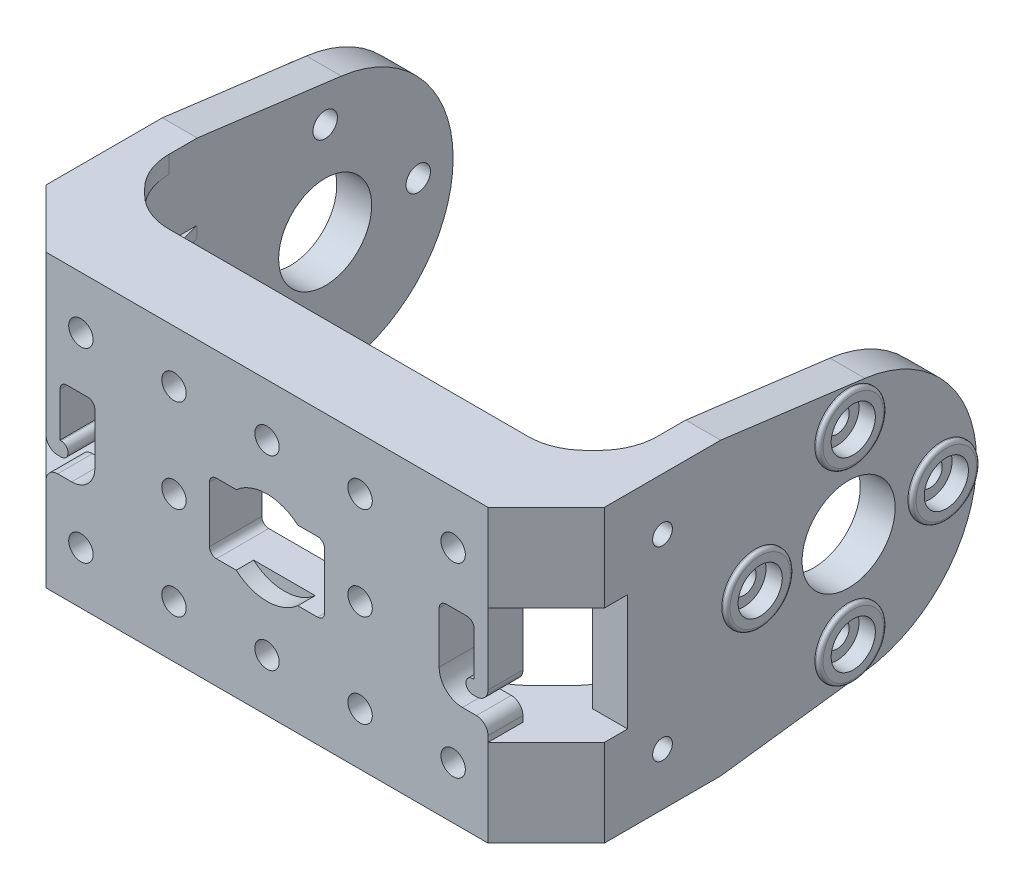
from build123d import *

# Parameters (mm, degrees)
BOSS_EXTRU_1_DEPTH                  = 1
BOSS_EXTRU_2_DEPTH                  = 0.5
ENL_V_MAT_EXTRU_1_DEPTH             = 1
ENL_V_MAT_EXTRU_2_DEPTH             = 1
ENL_V_MAT_EXTRU_3_DEPTH             = 1
ENL_V_MAT_EXTRU_4_DEPTH             = 1
BOSS_EXTRU_3_DEPTH                  = 1
BOSS_EXTRU_4_DEPTH                  = 1
BOSS_EXTRU_5_DEPTH                  = 5
BOSS_EXTRU_6_DEPTH                  = 5
BOSS_EXTRU_7_DEPTH                  = 1.5
ENL_V_MAT_EXTRU_5_DEPTH             = 6
BOSS_EXTRU_8_DEPTH                  = 1.5
BOSS_EXTRU_9_DEPTH                  = 3
BOSS_EXTRU_10_START                 = 3
BOSS_EXTRU_10_DEPTH                 = 3
ENL_V_MAT_EXTRU_6_DEPTH             = 6
ENL_V_MAT_EXTRU_7_DEPTH             = 1.5
ENL_V_MAT_EXTRU_8_DEPTH             = 1.5
ENL_V_MAT_EXTRU_9_DEPTH             = 5
ENL_V_MAT_EXTRU_10_DEPTH            = 1.5
ENL_V_MAT_EXTRU_11_DEPTH            = 1.5
ENL_V_MAT_EXTRU_12_DEPTH            = 5
ESQUISSE23_W                        = 0.5
ESQUISSE23_H                        = 7
ENL_V_MAT_EXTRU_13_DEPTH            = 1.743065645
ESQUISSE24_W                        = 0.5
ESQUISSE24_H                        = 7
ENL_V_MAT_EXTRU_14_DEPTH            = 1.743065645
ESQUISSE25_W                        = 0.5
ESQUISSE25_H                        = 7
ENL_V_MAT_EXTRU_15_DEPTH            = 2.337822174
ESQUISSE26_W                        = 0.5
ESQUISSE26_H                        = 7
ENL_V_MAT_EXTRU_16_DEPTH            = 2.337822174
BOSS_EXTRU_11_DEPTH                 = 3
ENL_V_MAT_EXTRU_17_DEPTH            = 1
ENL_V_MAT_EXTRU_18_DEPTH            = 1.5
ENL_V_MAT_EXTRU_19_DEPTH            = 1
ENL_V_MAT_EXTRU_20_DEPTH            = 1
ENL_V_MAT_EXTRU_21_DEPTH            = 1
ENL_V_MAT_EXTRU_22_DEPTH            = 0.5
ENL_V_MAT_EXTRU_23_DEPTH            = 1
ENL_V_MAT_EXTRU_24_DEPTH            = 1
ENL_V_MAT_EXTRU_25_DEPTH            = 1
ENL_V_MAT_EXTRU_26_DEPTH            = 1
ENL_V_MAT_EXTRU_27_DEPTH            = 2
ENL_V_MAT_EXTRU_28_DEPTH            = 1
ENL_V_MAT_EXTRU_29_DEPTH            = 2
ENL_V_MAT_EXTRU_30_DEPTH            = 1
ENL_V_MAT_EXTRU_31_DEPTH            = 2
ENL_V_MAT_EXTRU_32_DEPTH            = 1
ENL_V_MAT_EXTRU_33_DEPTH            = 2
ENL_V_MAT_EXTRU_34_DEPTH            = 1
ENL_V_MAT_EXTRU_35_DEPTH            = 2
ENL_V_MAT_EXTRU_36_DEPTH            = 1
ENL_V_MAT_EXTRU_37_DEPTH            = 1
ENL_V_MAT_EXTRU_38_DEPTH            = 2
ENL_V_MAT_EXTRU_39_DEPTH            = 1
ENL_V_MAT_EXTRU_40_DEPTH            = 1
ESQUISSE52_W                        = 9.9
ESQUISSE52_H                        = 6
ENL_V_MAT_EXTRU_41_DEPTH            = 46.839393539
ENL_V_MAT_EXTRU_42_DEPTH            = 1.5
ENL_V_MAT_EXTRU_43_DEPTH            = 1.5
ENL_V_MAT_EXTRU_44_DEPTH            = 2
ENL_V_MAT_EXTRU_45_DEPTH            = 2
ENL_V_MAT_EXTRU_46_DEPTH            = 2
ENL_V_MAT_EXTRU_47_DEPTH            = 2
ENL_V_MAT_EXTRU_48_DEPTH            = 2
ENL_V_MAT_EXTRU_49_DEPTH            = 2
ESQUISSE61_W                        = 0.4
ESQUISSE61_H                        = 2.9
ESQUISSE62_W                        = 0.4
ESQUISSE62_H                        = 2.9
ESQUISSE63_W                        = 0.4
ESQUISSE63_H                        = 2.9
ESQUISSE64_W                        = 0.4
ESQUISSE64_H                        = 2.9
ESQUISSE65_W                        = 0.4
ESQUISSE65_H                        = 2.9
ESQUISSE66_W                        = 0.4
ESQUISSE66_H                        = 2.9
ESQUISSE67_W                        = 0.4
ESQUISSE67_H                        = 2.9
ESQUISSE68_W                        = 0.4
ESQUISSE68_H                        = 2.9
DIAM_TRE_DU_PER_AGE_2_1_2_1_1_D     = 2.1
DIAM_TRE_DU_PER_AGE_1_7_1_7_1_D     = 1.7
DIAM_TRE_DU_PER_AGE_1_7_1_7_1_DEPTH = 3
DIAM_TRE_DU_PER_AGE_8_0_8_1_D       = 8
DIAM_TRE_DU_PER_AGE_8_0_8_1_DEPTH   = 3
DIAM_TRE_DU_PER_AGE_1_7_1_7_2_D     = 1.7
DIAM_TRE_DU_PER_AGE_1_7_1_7_2_DEPTH = 48.4
DIAM_TRE_DU_PER_AGE_8_0_8_2_D       = 8
DIAM_TRE_DU_PER_AGE_8_0_8_2_DEPTH   = 48.4
PER_AGE1_D                          = 2.1
PER_AGE1_DEPTH                      = 3.4
PER_AGE1_CBORE_D                    = 3.8
PER_AGE1_CBORE_DEPTH                = 1.4
PER_AGE2_D                          = 2.1
PER_AGE2_DEPTH                      = 48.8
PER_AGE2_CBORE_D                    = 3.8
PER_AGE2_CBORE_DEPTH                = 1.4
CHANFREIN1_SIZE                     = 5
CONG_1_R                            = 0.3
CONG_2_R                            = 0.6
CONG_3_R                            = 1
CONG_4_R                            = 2
CONG_5_R                            = 5


with BuildPart() as part:
    # Esquisse1 → Boss.-Extru.1 (new body)
    with BuildSketch(Plane.XY.offset(23)):
        Polygon((14.595606444, -5), (10.080887819, -3.5), (10.080887819, -2.493640581), (11.2, -1.847520861), (11.2, 1.847520861), (10.080887819, 2.493640581), (10.080887819, 3.5), (14.595606444, 5), (-14.595606444, 5), (-10.080887819, 3.5), (-10.080887819, 2.493640581), (-11.2, 1.847520861), (-11.2, -1.847520861), (-10.080887819, -2.493640581), (-10.080887819, -3.5), (-14.595606444, -5), align=None)
    extrude(amount=-BOSS_EXTRU_1_DEPTH)

    # Esquisse2 → Boss.-Extru.2 (add)
    with BuildSketch(Plane(origin=(0, 0, 22), x_dir=(-1, 0, 0), z_dir=(0, 0, -1))):
        Polygon((-14.595606444, 5), (14.595606444, 5), (10.080887819, 3.5), (10.080887819, -3.5), (14.595606444, -5), (-14.595606444, -5), (-10.080887819, -3.5), (-10.080887819, 3.5), align=None)
    extrude(amount=BOSS_EXTRU_2_DEPTH)

    # Esquisse3 → Enlèv. mat.-Extru.1 (cut)
    with BuildSketch(Plane.XY.offset(23)):
        Polygon((10.080887819, 3.5), (8.337822174, 3.5), (10.080887819, 2.493640581), align=None)
    extrude(amount=-ENL_V_MAT_EXTRU_1_DEPTH, mode=Mode.SUBTRACT)

    # Esquisse4 → Enlèv. mat.-Extru.2 (cut)
    with BuildSketch(Plane.XY.offset(23)):
        Polygon((10.080887819, -3.5), (10.080887819, -2.493640581), (8.337822174, -3.5), align=None)
    extrude(amount=-ENL_V_MAT_EXTRU_2_DEPTH, mode=Mode.SUBTRACT)

    # Esquisse5 → Enlèv. mat.-Extru.3 (cut)
    with BuildSketch(Plane.XY.offset(23)):
        Polygon((-10.080887819, -3.5), (-8.337822174, -3.5), (-10.080887819, -2.493640581), align=None)
    extrude(amount=-ENL_V_MAT_EXTRU_3_DEPTH, mode=Mode.SUBTRACT)

    # Esquisse6 → Enlèv. mat.-Extru.4 (cut)
    with BuildSketch(Plane.XY.offset(23)):
        Polygon((-10.080887819, 3.5), (-10.080887819, 2.493640581), (-8.337822174, 3.5), align=None)
    extrude(amount=-ENL_V_MAT_EXTRU_4_DEPTH, mode=Mode.SUBTRACT)

    # Esquisse7 → Boss.-Extru.3 (add)
    with BuildSketch(Plane(origin=(0, 5, 0), x_dir=(-1, 0, 0), z_dir=(0, 1, 0))):
        Polygon((21, 23), (21, 11), (19.5, 17.014718626), (17.514718626, 19), (-17.514718626, 19), (-19.5, 17.014718626), (-21, 11), (-21, 23), align=None)
    extrude(amount=BOSS_EXTRU_3_DEPTH)

    # Esquisse8 → Boss.-Extru.4 (add)
    with BuildSketch(Plane.XZ.offset(5)):
        Polygon((-21, 11), (-21, 23), (21, 23), (21, 11), (19.5, 17.014718626), (17.514718626, 19), (-17.514718626, 19), (-19.5, 17.014718626), align=None)
    extrude(amount=BOSS_EXTRU_4_DEPTH)

    # Esquisse9 → Boss.-Extru.5 (add)
    with BuildSketch(Plane(origin=(0, 6, 0), x_dir=(-1, 0, 0), z_dir=(0, 1, 0))):
        Polygon((21, 23), (21, 11), (19.5, 17.014718626), (17.514718626, 19), (-17.514718626, 19), (-19.5, 17.014718626), (-21, 11), (-21, 23), align=None)
    extrude(amount=BOSS_EXTRU_5_DEPTH)

    # Esquisse10 → Boss.-Extru.6 (add)
    with BuildSketch(Plane.XZ.offset(6)):
        Polygon((-21, 11), (-21, 23), (21, 23), (21, 11), (19.5, 17.014718626), (17.514718626, 19), (-17.514718626, 19), (-19.5, 17.014718626), align=None)
    extrude(amount=BOSS_EXTRU_6_DEPTH)

    # Esquisse11 → Boss.-Extru.7 (add)
    with BuildSketch(Plane(origin=(0, 11, 0), x_dir=(-1, 0, 0), z_dir=(0, 1, 0))):
        Polygon((21, 23), (21, 11), (19.5, 17.014718626), (17.514718626, 19), (-17.514718626, 19), (-19.5, 17.014718626), (-21, 11), (-21, 23), align=None)
    extrude(amount=BOSS_EXTRU_7_DEPTH)

    # Esquisse12 → Enlèv. mat.-Extru.5 (cut)
    with BuildSketch(Plane.XZ.offset(-5)):
        Polygon((-17.514718626, 19), (17.514718626, 19), (15.014718626, 21.5), (-15.014718626, 21.5), align=None)
    extrude(amount=-ENL_V_MAT_EXTRU_5_DEPTH, mode=Mode.SUBTRACT)

    # Esquisse13 → Boss.-Extru.8 (add)
    with BuildSketch(Plane.XZ.offset(11)):
        Polygon((-21, 11), (-21, 23), (21, 23), (21, 11), (19.5, 17.014718626), (17.514718626, 19), (-17.514718626, 19), (-19.5, 17.014718626), align=None)
    extrude(amount=BOSS_EXTRU_8_DEPTH)

    # Esquisse14 → Boss.-Extru.9 (add)
    with BuildSketch(Plane.ZY.offset(21)):
        with BuildLine():
            Line((23, 12.5), (23, 5))
            Line((23, 5), (19, 5))
            Line((19, 5), (19, -5))
            Line((19, -5), (23, -5))
            Line((23, -5), (23, -12.5))
            Line((23, -12.5), (11, -12.5))
            Line((11, -12.5), (-1.398557259, -10.910730388))
            ThreePointArc((-1.398557259, -10.910730388), (-11, 0), (-1.398557259, 10.910730388))
            Line((-1.398557259, 10.910730388), (11, 12.5))
            Line((11, 12.5), (23, 12.5))
        make_face()
    extrude(amount=BOSS_EXTRU_9_DEPTH)

    # Esquisse15 → Boss.-Extru.10 (add)
    with BuildSketch(Plane(origin=(21, 0, 0), x_dir=(0, 0, -1), z_dir=(1, 0, 0)).offset(BOSS_EXTRU_10_START)):
        with BuildLine():
            Line((-23, 12.5), (-11, 12.5))
            Line((-11, 12.5), (1.398557259, 10.910730388))
            ThreePointArc((1.398557259, 10.910730388), (11, 0), (1.398557259, -10.910730388))
            Line((1.398557259, -10.910730388), (-11, -12.5))
            Line((-11, -12.5), (-23, -12.5))
            Line((-23, -12.5), (-23, -5))
            Line((-23, -5), (-19, -5))
            Line((-19, -5), (-19, 5))
            Line((-19, 5), (-23, 5))
            Line((-23, 5), (-23, 12.5))
        make_face()
    extrude(amount=-BOSS_EXTRU_10_DEPTH)

    # Esquisse16 → Enlèv. mat.-Extru.6 (cut)
    with BuildSketch(Plane(origin=(0, -5, 0), x_dir=(-1, 0, 0), z_dir=(0, 1, 0))):
        Polygon((17.514718626, 19), (15.014718626, 21.5), (-15.014718626, 21.5), (-17.514718626, 19), align=None)
    extrude(amount=-ENL_V_MAT_EXTRU_6_DEPTH, mode=Mode.SUBTRACT)

    # Esquisse17 → Enlèv. mat.-Extru.7 (cut)
    with BuildSketch(Plane.XZ.offset(12.5)):
        Polygon((21, 15.514718626), (19.5, 17.014718626), (21, 11), align=None)
    extrude(amount=-ENL_V_MAT_EXTRU_7_DEPTH, mode=Mode.SUBTRACT)

    # Esquisse18 → Enlèv. mat.-Extru.8 (cut)
    with BuildSketch(Plane.XZ.offset(12.5)):
        Polygon((-19.5, 17.014718626), (-21, 15.514718626), (-21, 11), align=None)
    extrude(amount=-ENL_V_MAT_EXTRU_8_DEPTH, mode=Mode.SUBTRACT)

    # Esquisse19 → Enlèv. mat.-Extru.9 (cut)
    with BuildSketch(Plane.XZ.offset(11)):
        Polygon((21, 22), (-21, 22), (-21, 11), (-19.5, 17.014718626), (-15.014718626, 21.5), (15.014718626, 21.5), (19.5, 17.014718626), (21, 11), align=None)
    extrude(amount=-ENL_V_MAT_EXTRU_9_DEPTH, mode=Mode.SUBTRACT)

    # Esquisse20 → Enlèv. mat.-Extru.10 (cut)
    with BuildSketch(Plane(origin=(0, 12.5, 0), x_dir=(-1, 0, 0), z_dir=(0, 1, 0))):
        Polygon((-21, 11), (-19.5, 17.014718626), (-21, 15.514718626), align=None)
    extrude(amount=-ENL_V_MAT_EXTRU_10_DEPTH, mode=Mode.SUBTRACT)

    # Esquisse21 → Enlèv. mat.-Extru.11 (cut)
    with BuildSketch(Plane(origin=(0, 12.5, 0), x_dir=(-1, 0, 0), z_dir=(0, 1, 0))):
        Polygon((21, 11), (21, 15.514718626), (19.5, 17.014718626), align=None)
    extrude(amount=-ENL_V_MAT_EXTRU_11_DEPTH, mode=Mode.SUBTRACT)

    # Esquisse22 → Enlèv. mat.-Extru.12 (cut)
    with BuildSketch(Plane(origin=(0, 11, 0), x_dir=(-1, 0, 0), z_dir=(0, 1, 0))):
        Polygon((21, 11), (21, 22), (-21, 22), (-21, 11), (-19.5, 17.014718626), (-15.014718626, 21.5), (15.014718626, 21.5), (19.5, 17.014718626), align=None)
    extrude(amount=-ENL_V_MAT_EXTRU_12_DEPTH, mode=Mode.SUBTRACT)

    # Esquisse23 → Enlèv. mat.-Extru.13 (cut)
    with BuildSketch(Plane.ZY.offset(10.080887819)):
        with Locations((21.75, 0)):
            Rectangle(ESQUISSE23_W, ESQUISSE23_H)
    extrude(amount=-ENL_V_MAT_EXTRU_13_DEPTH, mode=Mode.SUBTRACT)

    # Esquisse24 → Enlèv. mat.-Extru.14 (cut)
    with BuildSketch(Plane(origin=(10.080887819, 0, 0), x_dir=(0, 0, -1), z_dir=(1, 0, 0))):
        with Locations((-21.75, 0)):
            Rectangle(ESQUISSE24_W, ESQUISSE24_H)
    extrude(amount=-ENL_V_MAT_EXTRU_14_DEPTH, mode=Mode.SUBTRACT)

    # Esquisse25 → Enlèv. mat.-Extru.15 (cut)
    with BuildSketch(Plane.ZY.offset(8.337822174)):
        with Locations((21.75, 0)):
            Rectangle(ESQUISSE25_W, ESQUISSE25_H)
    extrude(amount=-ENL_V_MAT_EXTRU_15_DEPTH, mode=Mode.SUBTRACT)

    # Esquisse26 → Enlèv. mat.-Extru.16 (cut)
    with BuildSketch(Plane(origin=(8.337822174, 0, 0), x_dir=(0, 0, -1), z_dir=(1, 0, 0))):
        with Locations((-21.75, 0)):
            Rectangle(ESQUISSE26_W, ESQUISSE26_H)
    extrude(amount=-ENL_V_MAT_EXTRU_16_DEPTH, mode=Mode.SUBTRACT)

    # Esquisse27 → Boss.-Extru.11 (add)
    with BuildSketch(Plane.XY.offset(23)):
        with BuildLine():
            Line((14.8, -3.5), (19, -3.5))
            Line((19, -3.5), (19, -5))
            Line((19, -5), (24, -5))
            Line((24, -5), (24, -12.5))
            Line((24, -12.5), (-24, -12.5))
            Line((-24, -12.5), (-24, -5))
            Line((-24, -5), (-19, -5))
            Line((-19, -5), (-19, -3.5))
            Line((-19, -3.5), (-14.8, -3.5))
            Line((-14.8, -3.5), (-14.8, 3.5))
            Line((-14.8, 3.5), (-17.8, 3.5))
            Line((-17.8, 3.5), (-17.8, -0.9))
            Line((-17.8, -0.9), (-17.7, -0.9))
            ThreePointArc((-17.7, -0.9), (-17.1, -1.5), (-17.7, -2.1))
            Line((-17.7, -2.1), (-19, -2.1))
            Line((-19, -2.1), (-19, 5))
            Line((-19, 5), (-24, 5))
            Line((-24, 5), (-24, 12.5))
            Line((-24, 12.5), (24, 12.5))
            Line((24, 12.5), (24, 5))
            Line((24, 5), (19, 5))
            Line((19, 5), (19, -2.1))
            Line((19, -2.1), (17.7, -2.1))
            ThreePointArc((17.7, -2.1), (17.1, -1.5), (17.7, -0.9))
            Line((17.7, -0.9), (17.8, -0.9))
            Line((17.8, -0.9), (17.8, 3.5))
            Line((17.8, 3.5), (14.8, 3.5))
            Line((14.8, 3.5), (14.8, -3.5))
        make_face()
    extrude(amount=BOSS_EXTRU_11_DEPTH)

    # Esquisse28 → Enlèv. mat.-Extru.17 (cut)
    with BuildSketch(Plane(origin=(0, 0, 22), x_dir=(-1, 0, 0), z_dir=(0, 0, -1))):
        Polygon((13.690598923, -6), (10.935898385, -6), (11.2, -6.152479139), (11.2, -9.847520861), (9.203847577, -11), (14.267949192, -11), (12.535898385, -8), align=None)
    extrude(amount=-ENL_V_MAT_EXTRU_17_DEPTH, mode=Mode.SUBTRACT)

    # Esquisse29 → Enlèv. mat.-Extru.18 (cut)
    with BuildSketch(Plane(origin=(0, 0, 21.5), x_dir=(-1, 0, 0), z_dir=(0, 0, -1))):
        Polygon((9.919112181, -4.5), (-9.919112181, -4.5), (-14.433830807, -6), (14.433830807, -6), align=None)
    extrude(amount=-ENL_V_MAT_EXTRU_18_DEPTH, mode=Mode.SUBTRACT)

    # Esquisse30 → Enlèv. mat.-Extru.19 (cut)
    with BuildSketch(Plane(origin=(0, 0, 22), x_dir=(-1, 0, 0), z_dir=(0, 0, -1))):
        Polygon((-4.8, -6.152479139), (-4.8, -9.847520861), (-6.796152423, -11), (-1.203847577, -11), (-3.2, -9.847520861), (-3.2, -6.152479139), (-0.337822174, -4.5), (-7.662177826, -4.5), align=None)
    extrude(amount=-ENL_V_MAT_EXTRU_19_DEPTH, mode=Mode.SUBTRACT)

    # Esquisse31 → Enlèv. mat.-Extru.20 (cut)
    with BuildSketch(Plane(origin=(0, 0, 22), x_dir=(-1, 0, 0), z_dir=(0, 0, -1))):
        Polygon((3.2, -6.152479139), (3.2, -9.847520861), (1.203847577, -11), (6.796152423, -11), (4.8, -9.847520861), (4.8, -6.152479139), (7.662177826, -4.5), (0.337822174, -4.5), align=None)
    extrude(amount=-ENL_V_MAT_EXTRU_20_DEPTH, mode=Mode.SUBTRACT)

    # Esquisse32 → Enlèv. mat.-Extru.21 (cut)
    with BuildSketch(Plane(origin=(0, 0, 22), x_dir=(-1, 0, 0), z_dir=(0, 0, -1))):
        Polygon((-13.810221356, -5.792807868), (-12.535898385, -8), (-14.267949192, -11), (-9.203847577, -11), (-11.2, -9.847520861), (-11.2, -6.152479139), (-8.337822174, -4.5), (-9.919112181, -4.5), align=None)
    extrude(amount=-ENL_V_MAT_EXTRU_21_DEPTH, mode=Mode.SUBTRACT)

    # Esquisse33 → Enlèv. mat.-Extru.22 (cut)
    with BuildSketch(Plane(origin=(0, 0, 21.5), x_dir=(-1, 0, 0), z_dir=(0, 0, -1))):
        Polygon((-9.919112181, 4.5), (9.919112181, 4.5), (14.433830807, 6), (-14.433830807, 6), align=None)
    extrude(amount=-ENL_V_MAT_EXTRU_22_DEPTH, mode=Mode.SUBTRACT)

    # Esquisse34 → Enlèv. mat.-Extru.23 (cut)
    with BuildSketch(Plane(origin=(0, 0, 22), x_dir=(-1, 0, 0), z_dir=(0, 0, -1))):
        Polygon((13.810221356, 5.792807868), (12.535898385, 8), (14.267949192, 11), (9.203847577, 11), (11.2, 9.847520861), (11.2, 6.152479139), (8.337822174, 4.5), (9.919112181, 4.5), align=None)
    extrude(amount=-ENL_V_MAT_EXTRU_23_DEPTH, mode=Mode.SUBTRACT)

    # Esquisse35 → Enlèv. mat.-Extru.24 (cut)
    with BuildSketch(Plane(origin=(0, 0, 22), x_dir=(-1, 0, 0), z_dir=(0, 0, -1))):
        Polygon((-3.2, 6.152479139), (-3.2, 9.847520861), (-1.203847577, 11), (-6.796152423, 11), (-4.8, 9.847520861), (-4.8, 6.152479139), (-7.662177826, 4.5), (-0.337822174, 4.5), align=None)
    extrude(amount=-ENL_V_MAT_EXTRU_24_DEPTH, mode=Mode.SUBTRACT)

    # Esquisse36 → Enlèv. mat.-Extru.25 (cut)
    with BuildSketch(Plane(origin=(0, 0, 22), x_dir=(-1, 0, 0), z_dir=(0, 0, -1))):
        Polygon((-11.2, 6.152479139), (-11.2, 9.847520861), (-9.203847577, 11), (-14.267949192, 11), (-12.535898385, 8), (-13.810221356, 5.792807868), (-9.919112181, 4.5), (-8.337822174, 4.5), align=None)
    extrude(amount=-ENL_V_MAT_EXTRU_25_DEPTH, mode=Mode.SUBTRACT)

    # Esquisse37 → Enlèv. mat.-Extru.26 (cut)
    with BuildSketch(Plane(origin=(0, 0, 22), x_dir=(-1, 0, 0), z_dir=(0, 0, -1))):
        Polygon((4.8, 6.152479139), (4.8, 9.847520861), (6.796152423, 11), (1.203847577, 11), (3.2, 9.847520861), (3.2, 6.152479139), (0.337822174, 4.5), (7.662177826, 4.5), align=None)
    extrude(amount=-ENL_V_MAT_EXTRU_26_DEPTH, mode=Mode.SUBTRACT)

    # Esquisse38 → Enlèv. mat.-Extru.27 (cut)
    with BuildSketch(Plane(origin=(0, 0, 22), x_dir=(-1, 0, 0), z_dir=(0, 0, -1))):
        Polygon((17.154700538, -10), (18.309401077, -8), (17.154700538, -6), (14.845299462, -6), (13.690598923, -8), (14.845299462, -10), align=None)
    extrude(amount=-ENL_V_MAT_EXTRU_27_DEPTH, mode=Mode.SUBTRACT)

    # Esquisse39 → Enlèv. mat.-Extru.28 (cut)
    with BuildSketch(Plane(origin=(0, 0, 22), x_dir=(-1, 0, 0), z_dir=(0, 0, -1))):
        Polygon((17.732050808, -11), (21, -11), (21, -6), (18.309401077, -6), (19.464101615, -8), align=None)
    extrude(amount=-ENL_V_MAT_EXTRU_28_DEPTH, mode=Mode.SUBTRACT)

    # Esquisse40 → Enlèv. mat.-Extru.29 (cut)
    with BuildSketch(Plane(origin=(0, 0, 22), x_dir=(-1, 0, 0), z_dir=(0, 0, -1))):
        Polygon((-17.154700538, -10), (-14.845299462, -10), (-13.690598923, -8), (-14.845299462, -6), (-17.154700538, -6), (-18.309401077, -8), align=None)
    extrude(amount=-ENL_V_MAT_EXTRU_29_DEPTH, mode=Mode.SUBTRACT)

    # Esquisse41 → Enlèv. mat.-Extru.30 (cut)
    with BuildSketch(Plane(origin=(0, 0, 22), x_dir=(-1, 0, 0), z_dir=(0, 0, -1))):
        Polygon((-21, -11), (-17.732050808, -11), (-19.464101615, -8), (-18.309401077, -6), (-21, -6), align=None)
    extrude(amount=-ENL_V_MAT_EXTRU_30_DEPTH, mode=Mode.SUBTRACT)

    # Esquisse42 → Enlèv. mat.-Extru.31 (cut)
    with BuildSketch(Plane(origin=(0, 0, 22), x_dir=(-1, 0, 0), z_dir=(0, 0, -1))):
        Polygon((-17.154700538, 10), (-18.309401077, 8), (-17.154700538, 6), (-14.845299462, 6), (-13.690598923, 8), (-14.845299462, 10), align=None)
    extrude(amount=-ENL_V_MAT_EXTRU_31_DEPTH, mode=Mode.SUBTRACT)

    # Esquisse43 → Enlèv. mat.-Extru.32 (cut)
    with BuildSketch(Plane(origin=(0, 0, 22), x_dir=(-1, 0, 0), z_dir=(0, 0, -1))):
        Polygon((-17.732050808, 11), (-21, 11), (-21, 6), (-18.309401077, 6), (-19.464101615, 8), align=None)
    extrude(amount=-ENL_V_MAT_EXTRU_32_DEPTH, mode=Mode.SUBTRACT)

    # Esquisse44 → Enlèv. mat.-Extru.33 (cut)
    with BuildSketch(Plane(origin=(0, 0, 22), x_dir=(-1, 0, 0), z_dir=(0, 0, -1))):
        Polygon((17.154700538, 10), (14.845299462, 10), (13.690598923, 8), (14.845299462, 6), (17.154700538, 6), (18.309401077, 8), align=None)
    extrude(amount=-ENL_V_MAT_EXTRU_33_DEPTH, mode=Mode.SUBTRACT)

    # Esquisse45 → Enlèv. mat.-Extru.34 (cut)
    with BuildSketch(Plane(origin=(0, 0, 22), x_dir=(-1, 0, 0), z_dir=(0, 0, -1))):
        Polygon((21, 11), (17.732050808, 11), (19.464101615, 8), (18.309401077, 6), (21, 6), align=None)
    extrude(amount=-ENL_V_MAT_EXTRU_34_DEPTH, mode=Mode.SUBTRACT)

    # Esquisse46 → Enlèv. mat.-Extru.35 (cut)
    with BuildSketch(Plane(origin=(0, 0, 22), x_dir=(-1, 0, 0), z_dir=(0, 0, -1))):
        Polygon((10, -1.154700538), (10, 1.154700538), (8, 2.309401077), (6, 1.154700538), (6, -1.154700538), (8, -2.309401077), align=None)
    extrude(amount=-ENL_V_MAT_EXTRU_35_DEPTH, mode=Mode.SUBTRACT)

    # Esquisse47 → Enlèv. mat.-Extru.36 (cut)
    with BuildSketch(Plane(origin=(0, 0, 22), x_dir=(-1, 0, 0), z_dir=(0, 0, -1))):
        Polygon((7.662177826, -3.5), (6, -2.540341184), (6, -3.5), align=None)
    extrude(amount=-ENL_V_MAT_EXTRU_36_DEPTH, mode=Mode.SUBTRACT)

    # Esquisse48 → Enlèv. mat.-Extru.37 (cut)
    with BuildSketch(Plane(origin=(0, 0, 22), x_dir=(-1, 0, 0), z_dir=(0, 0, -1))):
        Polygon((7.662177826, 3.5), (6, 3.5), (6, 2.540341184), align=None)
    extrude(amount=-ENL_V_MAT_EXTRU_37_DEPTH, mode=Mode.SUBTRACT)

    # Esquisse49 → Enlèv. mat.-Extru.38 (cut)
    with BuildSketch(Plane(origin=(0, 0, 22), x_dir=(-1, 0, 0), z_dir=(0, 0, -1))):
        Polygon((-6, -1.154700538), (-6, 1.154700538), (-8, 2.309401077), (-10, 1.154700538), (-10, -1.154700538), (-8, -2.309401077), align=None)
    extrude(amount=-ENL_V_MAT_EXTRU_38_DEPTH, mode=Mode.SUBTRACT)

    # Esquisse50 → Enlèv. mat.-Extru.39 (cut)
    with BuildSketch(Plane(origin=(0, 0, 22), x_dir=(-1, 0, 0), z_dir=(0, 0, -1))):
        Polygon((-7.662177826, 3.5), (-6, 2.540341184), (-6, 3.5), align=None)
    extrude(amount=-ENL_V_MAT_EXTRU_39_DEPTH, mode=Mode.SUBTRACT)

    # Esquisse51 → Enlèv. mat.-Extru.40 (cut)
    with BuildSketch(Plane(origin=(0, 0, 22), x_dir=(-1, 0, 0), z_dir=(0, 0, -1))):
        Polygon((-7.662177826, -3.5), (-6, -3.5), (-6, -2.540341184), align=None)
    extrude(amount=-ENL_V_MAT_EXTRU_40_DEPTH, mode=Mode.SUBTRACT)

    # Esquisse52 → Enlèv. mat.-Extru.41 (cut, through all)
    with BuildSketch(Plane.XY.offset(26)):
        Rectangle(ESQUISSE52_W, ESQUISSE52_H)
    extrude(amount=-ENL_V_MAT_EXTRU_41_DEPTH, mode=Mode.SUBTRACT)

    # Esquisse53 → Enlèv. mat.-Extru.42 (cut)
    with BuildSketch(Plane.XY.offset(26)):
        with BuildLine():
            Line((2.645751311, -3), (-2.645751311, -3))
            ThreePointArc((-2.645751311, -3), (0, -4), (2.645751311, -3))
        make_face()
    extrude(amount=-ENL_V_MAT_EXTRU_42_DEPTH, mode=Mode.SUBTRACT)

    # Esquisse54 → Enlèv. mat.-Extru.43 (cut)
    with BuildSketch(Plane.XY.offset(26)):
        with BuildLine():
            Line((-2.645751311, 3), (2.645751311, 3))
            ThreePointArc((2.645751311, 3), (0, 4), (-2.645751311, 3))
        make_face()
    extrude(amount=-ENL_V_MAT_EXTRU_43_DEPTH, mode=Mode.SUBTRACT)

    # Esquisse55 → Enlèv. mat.-Extru.44 (cut)
    with BuildSketch(Plane(origin=(0, 0, 22), x_dir=(-1, 0, 0), z_dir=(0, 0, -1))):
        Polygon((0, -10.309401077), (2, -9.154700538), (2, -6.845299462), (0, -5.690598923), (-2, -6.845299462), (-2, -9.154700538), align=None)
    extrude(amount=-ENL_V_MAT_EXTRU_44_DEPTH, mode=Mode.SUBTRACT)

    # Esquisse56 → Enlèv. mat.-Extru.45 (cut)
    with BuildSketch(Plane(origin=(0, 0, 22), x_dir=(-1, 0, 0), z_dir=(0, 0, -1))):
        Polygon((0, 5.690598923), (2, 6.845299462), (2, 9.154700538), (0, 10.309401077), (-2, 9.154700538), (-2, 6.845299462), align=None)
    extrude(amount=-ENL_V_MAT_EXTRU_45_DEPTH, mode=Mode.SUBTRACT)

    # Esquisse57 → Enlèv. mat.-Extru.46 (cut)
    with BuildSketch(Plane(origin=(0, 0, 22), x_dir=(-1, 0, 0), z_dir=(0, 0, -1))):
        Polygon((-8, -10.309401077), (-6, -9.154700538), (-6, -6.845299462), (-8, -5.690598923), (-10, -6.845299462), (-10, -9.154700538), align=None)
    extrude(amount=-ENL_V_MAT_EXTRU_46_DEPTH, mode=Mode.SUBTRACT)

    # Esquisse58 → Enlèv. mat.-Extru.47 (cut)
    with BuildSketch(Plane(origin=(0, 0, 22), x_dir=(-1, 0, 0), z_dir=(0, 0, -1))):
        Polygon((-8, 5.690598923), (-6, 6.845299462), (-6, 9.154700538), (-8, 10.309401077), (-10, 9.154700538), (-10, 6.845299462), align=None)
    extrude(amount=-ENL_V_MAT_EXTRU_47_DEPTH, mode=Mode.SUBTRACT)

    # Esquisse59 → Enlèv. mat.-Extru.48 (cut)
    with BuildSketch(Plane(origin=(0, 0, 22), x_dir=(-1, 0, 0), z_dir=(0, 0, -1))):
        Polygon((8, 5.690598923), (10, 6.845299462), (10, 9.154700538), (8, 10.309401077), (6, 9.154700538), (6, 6.845299462), align=None)
    extrude(amount=-ENL_V_MAT_EXTRU_48_DEPTH, mode=Mode.SUBTRACT)

    # Esquisse60 → Enlèv. mat.-Extru.49 (cut)
    with BuildSketch(Plane(origin=(0, 0, 22), x_dir=(-1, 0, 0), z_dir=(0, 0, -1))):
        Polygon((8, -10.309401077), (10, -9.154700538), (10, -6.845299462), (8, -5.690598923), (6, -6.845299462), (6, -9.154700538), align=None)
    extrude(amount=-ENL_V_MAT_EXTRU_49_DEPTH, mode=Mode.SUBTRACT)

    # Esquisse61 → Révolution1 (revolve)
    with BuildSketch(Plane.XY):
        with Locations((24.2, 9.45)):
            Rectangle(ESQUISSE61_W, ESQUISSE61_H)
    revolve(axis=Axis((24, 8, 0), (1, 0, 0)))

    # Esquisse62 → Révolution2 (revolve)
    with BuildSketch(Plane.XY.offset(-8)):
        with Locations((24.2, 1.45)):
            Rectangle(ESQUISSE62_W, ESQUISSE62_H)
    revolve(axis=Axis((24, 0, -8), (1, 0, 0)))

    # Esquisse63 → Révolution3 (revolve)
    with BuildSketch(Plane.XY):
        with Locations((24.2, -6.55)):
            Rectangle(ESQUISSE63_W, ESQUISSE63_H)
    revolve(axis=Axis((24, -8, 0), (1, 0, 0)))

    # Esquisse64 → Révolution4 (revolve)
    with BuildSketch(Plane.XY.offset(8)):
        with Locations((24.2, 1.45)):
            Rectangle(ESQUISSE64_W, ESQUISSE64_H)
    revolve(axis=Axis((24, 0, 8), (1, 0, 0)))

    # Esquisse65 → Révolution5 (revolve)
    with BuildSketch(Plane(origin=(0, 0, -8), x_dir=(-1, 0, 0), z_dir=(0, 0, -1))):
        with Locations((24.2, 1.45)):
            Rectangle(ESQUISSE65_W, ESQUISSE65_H)
    revolve(axis=Axis((-24, 0, -8), (-1, 0, 0)))

    # Esquisse66 → Révolution6 (revolve)
    with BuildSketch(Plane(origin=(0, 0, 0), x_dir=(-1, 0, 0), z_dir=(0, 0, -1))):
        with Locations((24.2, 9.45)):
            Rectangle(ESQUISSE66_W, ESQUISSE66_H)
    revolve(axis=Axis((-24, 8, 0), (-1, 0, 0)))

    # Esquisse67 → Révolution7 (revolve)
    with BuildSketch(Plane(origin=(0, 0, 8), x_dir=(-1, 0, 0), z_dir=(0, 0, -1))):
        with Locations((24.2, 1.45)):
            Rectangle(ESQUISSE67_W, ESQUISSE67_H)
    revolve(axis=Axis((-24, 0, 8), (-1, 0, 0)))

    # Esquisse68 → Révolution8 (revolve)
    with BuildSketch(Plane(origin=(0, 0, 0), x_dir=(-1, 0, 0), z_dir=(0, 0, -1))):
        with Locations((24.2, -6.55)):
            Rectangle(ESQUISSE68_W, ESQUISSE68_H)
    revolve(axis=Axis((-24, -8, 0), (-1, 0, 0)))

    # Diamètre du perçage Ø2.1 (2.1)1 (through all)
    with Locations(Plane(origin=(0, 0, 24), x_dir=(-1, 0, 0), z_dir=(0, 0, -1))):
        with Locations((0, -8), (8, 0), (0, 8), (-8, 0), (-8, -8), (-8, 8), (8, 8), (8, -8), (16, -8), (16, 8), (-16, 8), (-16, -8)):
            Hole(DIAM_TRE_DU_PER_AGE_2_1_2_1_1_D / 2)

    # Diamètre du perçage Ø1.7 (1.7)1
    with Locations(Plane(origin=(24, 0, 0), x_dir=(0, 0, -1), z_dir=(1, 0, 0))):
        with Locations((-16, -8), (-16, 8)):
            Hole(DIAM_TRE_DU_PER_AGE_1_7_1_7_1_D / 2, depth=DIAM_TRE_DU_PER_AGE_1_7_1_7_1_DEPTH)

    # Diamètre du perçage Ø8.0 (8)1
    with Locations(Plane(origin=(24, 0, 0), x_dir=(0, 0, -1), z_dir=(1, 0, 0))):
        with Locations((0, 0)):
            Hole(DIAM_TRE_DU_PER_AGE_8_0_8_1_D / 2, depth=DIAM_TRE_DU_PER_AGE_8_0_8_1_DEPTH)

    # Diamètre du perçage Ø1.7 (1.7)2
    with Locations(Plane.ZY.offset(24)):
        with Locations((16, -8), (16, 8)):
            Hole(DIAM_TRE_DU_PER_AGE_1_7_1_7_2_D / 2, depth=DIAM_TRE_DU_PER_AGE_1_7_1_7_2_DEPTH)

    # Diamètre du perçage Ø8.0 (8)2
    with Locations(Plane.ZY.offset(24)):
        with Locations((0, 0)):
            Hole(DIAM_TRE_DU_PER_AGE_8_0_8_2_D / 2, depth=DIAM_TRE_DU_PER_AGE_8_0_8_2_DEPTH)

    # Perçage1
    with Locations(Plane(origin=(24.4, 0, 0), x_dir=(0, 0, -1), z_dir=(1, 0, 0))):
        with Locations((-8, 0), (0, 8), (8, 0), (0, -8)):
            CounterBoreHole(PER_AGE1_D / 2, PER_AGE1_CBORE_D / 2, PER_AGE1_CBORE_DEPTH, depth=PER_AGE1_DEPTH)

    # Perçage2
    with Locations(Plane.ZY.offset(24.4)):
        with Locations((8, 0), (0, 8), (-8, 0), (0, -8)):
            CounterBoreHole(PER_AGE2_D / 2, PER_AGE2_CBORE_D / 2, PER_AGE2_CBORE_DEPTH, depth=PER_AGE2_DEPTH)

    # Chanfrein1
    chanfrein1_edges = [part.edges().sort_by_distance(p)[0] for p in [
        (24, 8.75, 26),
        (-24, -8.75, 26),
        (-24, 8.75, 26),
        (24, -8.75, 26),
    ]]
    chamfer(chanfrein1_edges, length=CHANFREIN1_SIZE)

    # Congé1
    cong_1_edges = [part.edges().sort_by_distance(p)[0] for p in [
        (24.4, 5.1, 0),
        (24.4, -10.9, 0),
        (24.4, -2.9, 8),
        (-24.4, -10.9, 0),
        (24.4, -2.9, -8),
        (-24.4, -2.9, 8),
        (-24.4, -2.9, -8),
        (-24.4, 5.1, 0),
    ]]
    fillet(cong_1_edges, radius=CONG_1_R)

    # Congé2
    cong_2_edges = [part.edges().sort_by_distance(p)[0] for p in [
        (-4.95, -3, 23.75),
        (4.95, -3, 23.75),
        (-4.95, 3, 23.75),
        (4.95, 3, 23.75),
        (17.8, 3.5, 24.5),
        (14.8, 3.5, 24.5),
        (-17.8, 3.5, 24.5),
        (-14.8, 3.5, 24.5),
    ]]
    fillet(cong_2_edges, radius=CONG_2_R)

    # Congé3
    cong_3_edges = [part.edges().sort_by_distance(p)[0] for p in [
        (19, -2.1, 24.5),
        (-19, -3.5, 24.5),
        (19, -3.5, 24.5),
        (-19, -2.1, 24.5),
    ]]
    fillet(cong_3_edges, radius=CONG_3_R)

    # Congé4
    cong_4_edges = [part.edges().sort_by_distance(p)[0] for p in [
        (14.8, -3.5, 24.5),
        (-14.8, -3.5, 24.5),
    ]]
    fillet(cong_4_edges, radius=CONG_4_R)

    # Congé5
    cong_5_edges = [part.edges().sort_by_distance(p)[0] for p in [
        (21, -11.75, 15.514718626),
        (21, 11.75, 15.514718626),
        (-17.514718626, 11.75, 19),
        (15.014718626, 5.5, 21.5),
        (-17.514718626, -11.75, 19),
        (19.5, 5.5, 17.014718626),
        (17.514718626, 11.75, 19),
        (-15.014718626, 5.5, 21.5),
        (-21, 11.75, 15.514718626),
        (-19.5, 5.5, 17.014718626),
        (-21, -11.75, 15.514718626),
        (-15.014718626, -5.5, 21.5),
        (17.514718626, -11.75, 19),
        (19.5, -5.5, 17.014718626),
        (15.014718626, -5.5, 21.5),
        (-19.5, -5.5, 17.014718626),
    ]]
    fillet(cong_5_edges, radius=CONG_5_R)


solid = part.part
